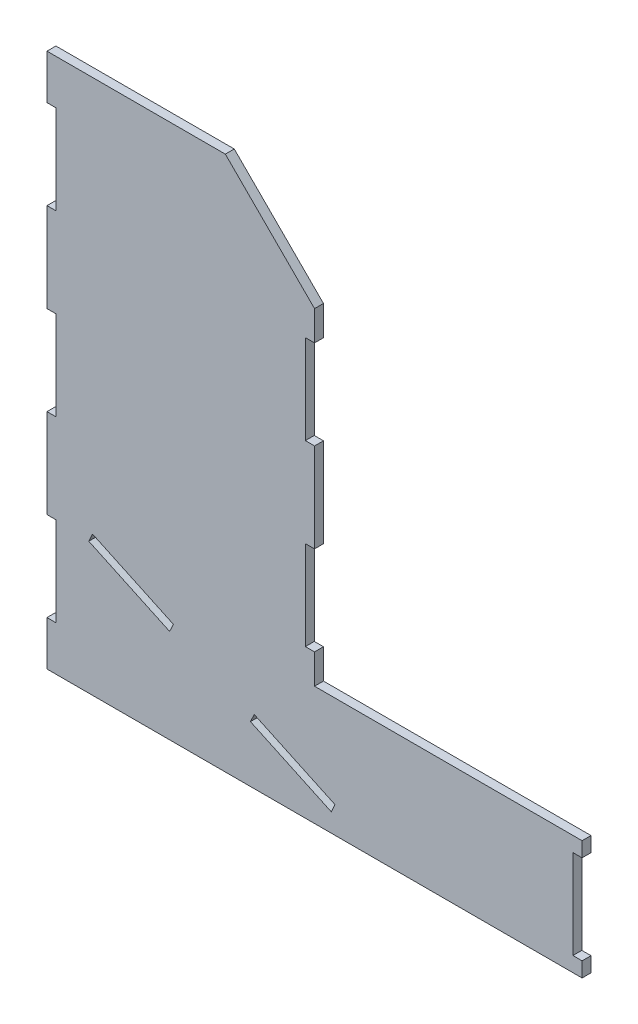
from build123d import *

# Parameters (mm, degrees)
BOSS_EXTRUDE1_DEPTH          = 1.5
CUT_EXTRUDE_THIN1_DEPTH      = 149.017202979
CUT_EXTRUDE_THIN1_DEPTH_BACK = 149.017202979
SKETCH1_3_W                  = 3.18
SKETCH1_3_H                  = 30
CUT_EXTRUDE1_REACH           = 150.04


with BuildPart() as part:
    # Sketch1 → Boss-Extrude1 (new, symmetric)
    with BuildSketch(Plane.XY):
        Polygon((-33.914893617, 114.397705985), (-93.914893617, 114.397705985), (-93.914893617, -65.602294015), (86.085106383, -65.602294015), (86.085106383, -25.602294015), (-3.914893617, -25.602294015), (-3.914893617, 84.397705985), align=None)
    extrude(amount=BOSS_EXTRUDE1_DEPTH, both=True)

    # Sketch1<3> → Cut-Extrude-Thin1 (cut, two sides: drawn at the far end of the back side and taken through both)
    with BuildSketch(Plane.XY.offset(-CUT_EXTRUDE_THIN1_DEPTH_BACK)):
        with Locations((-92.414893617, 84.397705985)):
            Rectangle(SKETCH1_3_W, SKETCH1_3_H)
        with Locations((-92.414893617, 24.397705985)):
            Rectangle(SKETCH1_3_W, SKETCH1_3_H)
        with Locations((-92.414893617, -35.602294015)):
            Rectangle(SKETCH1_3_W, SKETCH1_3_H)
        with Locations((-5.414893617, 59.397705985)):
            Rectangle(SKETCH1_3_W, SKETCH1_3_H)
        with Locations((-5.414893617, -0.602294015)):
            Rectangle(SKETCH1_3_W, SKETCH1_3_H)
        with Locations((84.585106383, -45.602294015)):
            Rectangle(SKETCH1_3_W, SKETCH1_3_H)
    extrude(amount=CUT_EXTRUDE_THIN1_DEPTH + CUT_EXTRUDE_THIN1_DEPTH_BACK, mode=Mode.SUBTRACT)

    # Sketch2 → Cut-Extrude1 (cut, up to next)
    with BuildSketch(Plane.XY.offset(1.5), mode=Mode.PRIVATE) as cut_extrude1_sk1:
        Polygon((-25.473348524, -46.697563546), (1.715885087, -59.376111398), (2.983739872, -56.657188037), (-24.205493739, -43.978640185), align=None)
    cut_extrude1_tool1 = extrude(cut_extrude1_sk1.sketch, amount=-CUT_EXTRUDE1_REACH, mode=Mode.PRIVATE) & part.part
    # Sketch2 → Cut-Extrude1 (cut, up to next)
    with BuildSketch(Plane.XY.offset(1.5), mode=Mode.PRIVATE) as cut_extrude1_sk2:
        Polygon((-51.39472735, -31.300092332), (-78.583960961, -18.62154448), (-79.851815747, -21.340467841), (-52.662582136, -34.019015693), align=None)
    cut_extrude1_tool2 = extrude(cut_extrude1_sk2.sketch, amount=-CUT_EXTRUDE1_REACH, mode=Mode.PRIVATE) & part.part
    add(cut_extrude1_tool1.solids().sort_by_distance((-11.244804, -51.677376, 1.5))[0], mode=Mode.SUBTRACT)
    add(cut_extrude1_tool2.solids().sort_by_distance((-65.623272, -26.32028, 1.5))[0], mode=Mode.SUBTRACT)


solid = part.part
